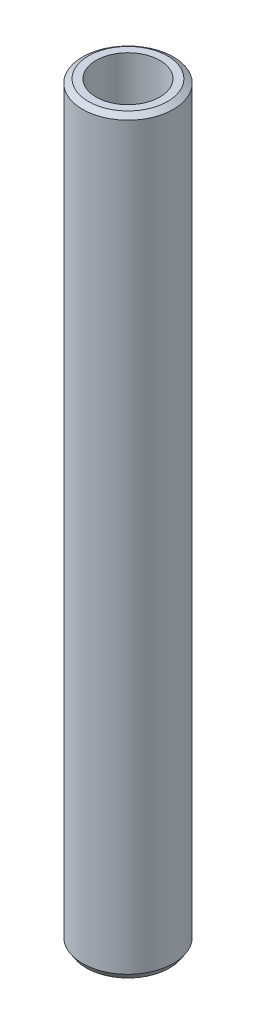
from build123d import *
from OCP.BRepFilletAPI import BRepFilletAPI_MakeChamfer

# Parameters (mm, degrees)
SKETCH1_R           = 30
BOSS_EXTRUDE1_DEPTH = 494.561998421
SKETCH2_R           = 21.018310428
CUT_EXTRUDE1_DEPTH  = 497.378454692
CHAMFER1_SIZE       = 2.519280943
CHAMFER1_SIZE2      = 3.893419727


with BuildPart() as part:
    # Sketch1 → Boss-Extrude1 (new body)
    with BuildSketch(Plane(origin=(0, 0, 0), x_dir=(1, 0, 0), z_dir=(0, 1, 0))):
        Circle(SKETCH1_R)
    extrude(amount=BOSS_EXTRUDE1_DEPTH)

    # Sketch2 → Cut-Extrude1 (cut, through all)
    with BuildSketch(Plane(origin=(0, 0, 0), x_dir=(1, 0, 0), z_dir=(0, 1, 0))):
        Circle(SKETCH2_R)
    extrude(amount=CUT_EXTRUDE1_DEPTH, mode=Mode.SUBTRACT)

    # Chamfer1: one chamfer whose edges measure the first distance from different faces: ONE call of the kernel's chamfer builder (chamfer() names one face for all edges)
    chamfer1_edges_1 = [part.edges().sort_by_distance(p)[0] for p in [
        (-30, 494.561998421, 0),
    ]]
    chamfer1_side_1 = [part.faces().sort_by_distance(p)[0] for p in [
        (-30, 247.280999211, 0),
    ]]
    chamfer1_edges_2 = [part.edges().sort_by_distance(p)[0] for p in [
        (-30, 0, 0),
    ]]
    chamfer1_side_2 = [part.faces().sort_by_distance(p)[0] for p in [
        (-29.151471863, 0, 0),
    ]]
    chamfer1 = BRepFilletAPI_MakeChamfer(part.part.solid().wrapped)
    for e in chamfer1_edges_1:
        chamfer1.Add(CHAMFER1_SIZE, CHAMFER1_SIZE2, e.wrapped, chamfer1_side_1[0].wrapped)  # the first distance lies on this face
    for e in chamfer1_edges_2:
        chamfer1.Add(CHAMFER1_SIZE, CHAMFER1_SIZE2, e.wrapped, chamfer1_side_2[0].wrapped)  # the first distance lies on this face
    add(Compound.cast(chamfer1.Shape()), mode=Mode.REPLACE)


solid = part.part
